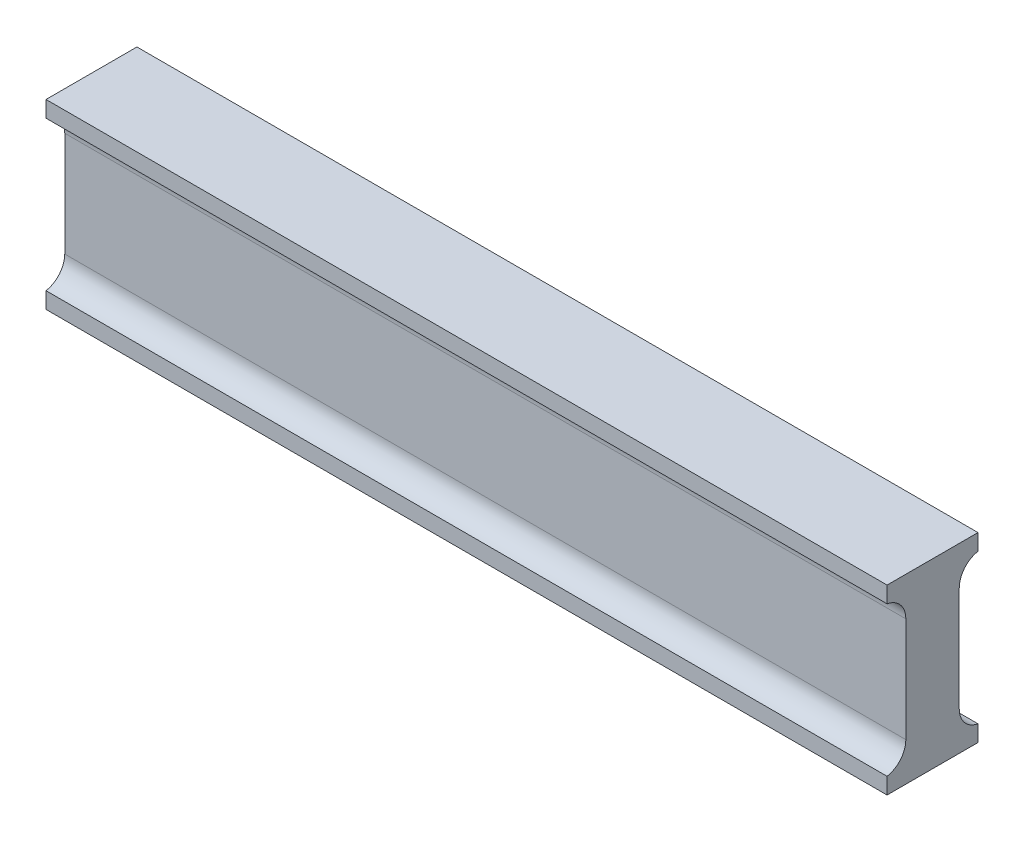
from build123d import *

# Parameters (mm, degrees)
SKETCH1_W           = 185
SKETCH1_H           = 40
BOSS_EXTRUDE1_DEPTH = 20
SKETCH2_W           = 8.25003803
SKETCH2_H           = 32.854024614
CUT_EXTRUDE1_DEPTH  = 188.149672722
FILLET1_R           = 5


with BuildPart() as part:
    # Sketch1 → Boss-Extrude1 (new body)
    with BuildSketch(Plane.XY):
        Rectangle(SKETCH1_W, SKETCH1_H)
    extrude(amount=BOSS_EXTRUDE1_DEPTH)

    # Sketch2 → Cut-Extrude1 (cut, through all)
    with BuildSketch(Plane(origin=(92.5, 0, 0), x_dir=(0, 0, -1), z_dir=(1, 0, 0))):
        with Locations((-20, 0)):
            Rectangle(SKETCH2_W, SKETCH2_H)
        Rectangle(SKETCH2_W, SKETCH2_H)
    extrude(amount=-CUT_EXTRUDE1_DEPTH, mode=Mode.SUBTRACT)

    # Fillet1
    # the kernel refuses this fillet: 5 mm, written as the material it adds along each edge
    with BuildSketch(Plane(origin=(92.5, 16.427012307, 4.125019015), x_dir=(0, 0, -1), z_dir=(-1, 0, 0)), Plane(origin=(92.5, -16.427012307, 15.874980985), x_dir=(0, 0, 1), z_dir=(-1, 0, 0))) as fillet1_piece_1:
        with BuildLine():
            CenterArc((5, 4.922845547), FILLET1_R, 180, 79.921563206)
            Line((0, 4.922845547), (-0.1, 4.922845547))
            Line((-0.1, 4.922845547), (-0.1, 0))
            Line((-0.1, 0), (0, -0.1))
            ThreePointArc((0, -0.1), (2.062509508, -0.1), (4.107519396, -0.098456911))
            Line((4.107519396, -0.098456911), (4.125019015, 0))
        make_face()
    extrude(amount=185)
    with BuildSketch(Plane(origin=(92.5, -16.427012307, 4.125019015), x_dir=(0, 1, 0), z_dir=(-1, 0, 0)), Plane(origin=(92.5, 16.427012307, 15.874980985), x_dir=(0, -1, 0), z_dir=(-1, 0, 0))) as fillet1_piece_2:
        with BuildLine():
            CenterArc((4.922845547, 5), FILLET1_R, 190.078436794, 79.921563206)
            Line((0, 4.125019015), (-0.098456911, 4.107519396))
            ThreePointArc((-0.098456911, 4.107519396), (-0.1, 2.062509508), (-0.1, 0))
            Line((-0.1, 0), (0, -0.1))
            Line((0, -0.1), (4.922845547, -0.1))
            Line((4.922845547, -0.1), (4.922845547, 0))
        make_face()
    extrude(amount=185)


solid = part.part
